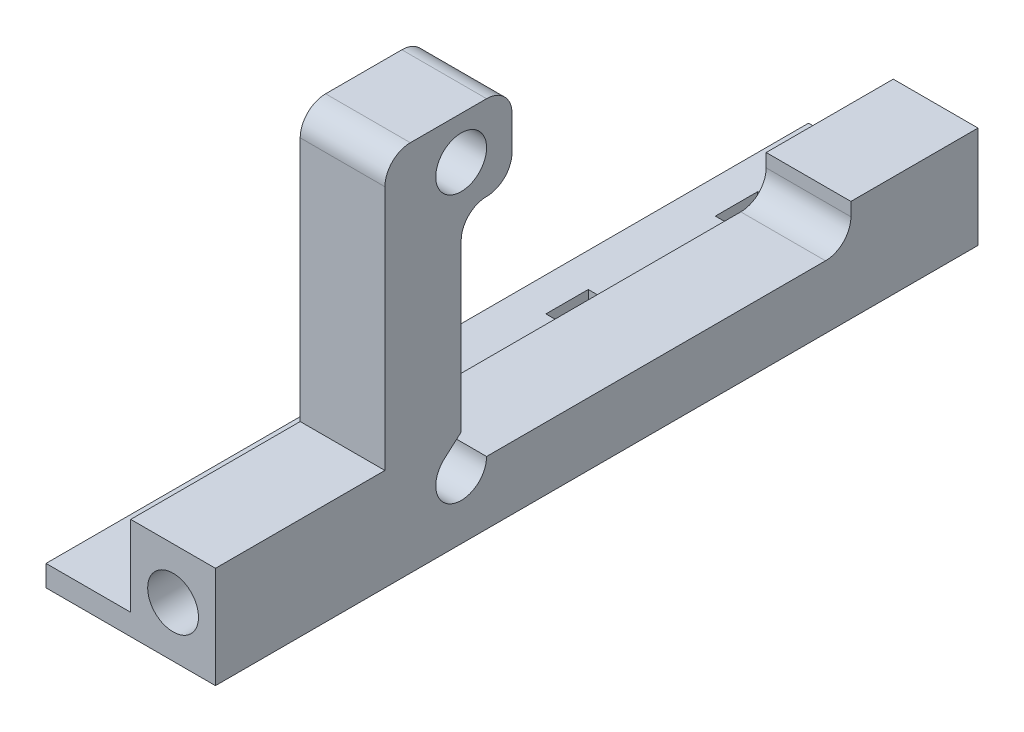
from build123d import *

# Parameters (mm, degrees)
ESBO_O1_R                = 3
RESSALTO_EXTRUS_O1_DEPTH = 10
ESBO_O2_R                = 3
CORTE_EXTRUS_O1_DEPTH    = 10
CORTE_EXTRUS_O2_START    = -80
ESBO_O2_2_R              = 3
CORTE_EXTRUS_O2_DEPTH    = 10
FILETE1_R                = 3
ESBO_O3_W                = 90
ESBO_O3_H                = 2.5
RESSALTO_EXTRUS_O2_DEPTH = 10
ESBO_O4_W                = 2
ESBO_O4_H                = 5
CORTE_EXTRUS_O3_DEPTH    = 10
PADR_O_LINEAR1_COUNT     = 4
PADR_O_LINEAR1_PITCH     = 20


with BuildPart() as part:
    # Esboço1 → Ressalto-extrusão1 (new body)
    with BuildSketch(Plane(origin=(0, 0, 0), x_dir=(0, 0, -1), z_dir=(1, 0, 0))):
        with BuildLine():
            Line((15, 44), (0, 44))
            Line((0, 44), (0, 12))
            Line((0, 12), (-20, 12))
            Line((-20, 12), (-20, 0))
            Line((-20, 0), (70, 0))
            Line((70, 0), (70, 12))
            Line((70, 12), (55, 12))
            Line((55, 12), (55, 7.43))
            Line((55, 7.43), (12, 7.43))
            ThreePointArc((12, 7.43), (7.765686518, 4.695686516), (7.015686515, 9.679999999))
            Line((7.015686515, 9.679999999), (9, 11.430000002))
            Line((9, 11.430000002), (9, 34))
            Line((9, 34), (15, 34))
            Line((15, 34), (15, 44))
        make_face()
        with Locations((9, 39)):
            Circle(ESBO_O1_R, mode=Mode.SUBTRACT)
    extrude(amount=RESSALTO_EXTRUS_O1_DEPTH)

    # Esboço2 → Corte-extrusão1 (cut)
    with BuildSketch(Plane(origin=(0, 0, -70), x_dir=(-1, 0, 0), z_dir=(0, 0, -1))):
        with Locations((-5, 6)):
            Circle(ESBO_O2_R)
    extrude(amount=-CORTE_EXTRUS_O1_DEPTH, mode=Mode.SUBTRACT)

    # Esboço2<2> → Corte-extrusão2 (cut)
    with BuildSketch(Plane(origin=(0, 0, -70), x_dir=(-1, 0, 0), z_dir=(0, 0, -1)).offset(CORTE_EXTRUS_O2_START)):
        with Locations((-5, 6)):
            Circle(ESBO_O2_2_R)
    extrude(amount=-CORTE_EXTRUS_O2_DEPTH, mode=Mode.SUBTRACT)

    # Filete1
    filete1_edges = [part.edges().sort_by_distance(p)[0] for p in [
        (5, 7.43, -55),
        (5, 44, 0),
        (5, 44, -15),
        (5, 34, -15),
        (5, 34, -9),
    ]]
    fillet(filete1_edges, radius=FILETE1_R - 0.0001)  # a hair under: the kernel refuses the full size

    # Esboço3 → Ressalto-extrusão2 (add)
    with BuildSketch(Plane.ZY):
        with Locations((-25, 1.25)):
            Rectangle(ESBO_O3_W, ESBO_O3_H)
    extrude(amount=RESSALTO_EXTRUS_O2_DEPTH)

    # Esboço4 → Corte-extrusão3 (cut)
    with BuildSketch(Plane(origin=(0, 2.5, 0), x_dir=(1, 0, 0), z_dir=(0, 1, 0))):
        with Locations((-5, 57.5)):
            Rectangle(ESBO_O4_W, ESBO_O4_H)
    corte_extrus_o3 = extrude(amount=-CORTE_EXTRUS_O3_DEPTH, mode=Mode.SUBTRACT)

    # Padrão linear1: Corte-extrusão3 ×4
    with Locations(*[(0, 0, i * PADR_O_LINEAR1_PITCH) for i in range(1, PADR_O_LINEAR1_COUNT)]):
        add(corte_extrus_o3, mode=Mode.SUBTRACT)


solid = part.part
